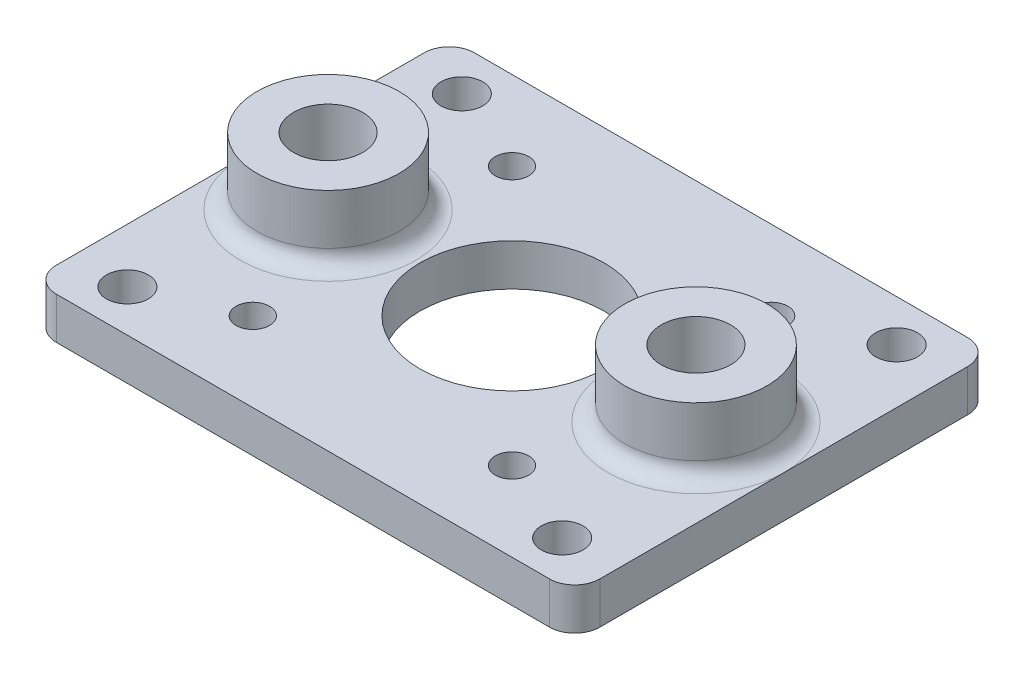
from build123d import *

# Parameters (mm, degrees)
SKETCH1_W           = 65
SKETCH1_H           = 50
SKETCH1_R           = 11
SKETCH1_R_2         = 2
SKETCH1_R_3         = 2.5
BOSS_EXTRUDE1_DEPTH = 5
SKETCH2_R           = 8.5
SKETCH2_R_2         = 4.15
BOSS_EXTRUDE2_DEPTH = 8
FILLET1_R           = 3
CUT_EXTRUDE1_START  = -8
SKETCH3_R           = 4.15
CUT_EXTRUDE1_DEPTH  = 8
FILLET2_R           = 2


with BuildPart() as part:
    # Sketch1 → Boss-Extrude1 (new body)
    with BuildSketch(Plane(origin=(0, 0, 0), x_dir=(1, 0, 0), z_dir=(0, 1, 0))):
        Rectangle(SKETCH1_W, SKETCH1_H)
        with Locations(Location((0, 0, 0), (0, 0, 270))):
            Circle(SKETCH1_R, mode=Mode.SUBTRACT)
        with Locations(Location((15.5, 15.5, 0), (0, 0, 270))):
            Circle(SKETCH1_R_2, mode=Mode.SUBTRACT)
        with Locations(Location((-15.5, 15.5, 0), (0, 0, 270))):
            Circle(SKETCH1_R_2, mode=Mode.SUBTRACT)
        with Locations(Location((15.5, -15.5, 0), (0, 0, 270))):
            Circle(SKETCH1_R_2, mode=Mode.SUBTRACT)
        with Locations(Location((-15.5, -15.5, 0), (0, 0, 270))):
            Circle(SKETCH1_R_2, mode=Mode.SUBTRACT)
        with Locations(Location((26, 20, 0), (0, 0, 270))):
            Circle(SKETCH1_R_3, mode=Mode.SUBTRACT)
        with Locations(Location((-26, 20, 0), (0, 0, 270))):
            Circle(SKETCH1_R_3, mode=Mode.SUBTRACT)
        with Locations(Location((-26, -20, 0), (0, 0, 270))):
            Circle(SKETCH1_R_3, mode=Mode.SUBTRACT)
        with Locations(Location((26, -20, 0), (0, 0, 270))):
            Circle(SKETCH1_R_3, mode=Mode.SUBTRACT)
    extrude(amount=BOSS_EXTRUDE1_DEPTH)

    # Sketch2 → Boss-Extrude2 (add)
    # profile 1 of 2: a face of its own
    with BuildSketch(Plane(origin=(0, 5, 0), x_dir=(1, 0, 0), z_dir=(0, 1, 0))):
        with Locations(Location((22, 0, 0), (0, 0, 270))):
            Circle(SKETCH2_R)
        with Locations(Location((22, 0, 0), (0, 0, 270))):
            Circle(SKETCH2_R_2, mode=Mode.SUBTRACT)
    # profile 2 of 2: a face of its own
    with BuildSketch(Plane(origin=(0, 5, 0), x_dir=(1, 0, 0), z_dir=(0, 1, 0))):
        with Locations(Location((-22, 0, 0), (0, 0, 90))):
            Circle(SKETCH2_R)
        with Locations(Location((-22, 0, 0), (0, 0, 90))):
            Circle(SKETCH2_R_2, mode=Mode.SUBTRACT)
    extrude(amount=BOSS_EXTRUDE2_DEPTH)

    # Fillet1
    fillet1_edges = [part.edges().sort_by_distance(p)[0] for p in [
        (32.5, 2.5, 25),
        (-32.5, 2.5, 25),
        (-32.5, 2.5, -25),
        (32.5, 2.5, -25),
    ]]
    fillet(fillet1_edges, radius=FILLET1_R)

    # Sketch3 → Cut-Extrude1 (cut)
    with BuildSketch(Plane(origin=(0, 5, 0), x_dir=(1, 0, 0), z_dir=(0, 1, 0)).offset(CUT_EXTRUDE1_START)):
        with Locations(Location((-22, 0, 0), (0, 0, 90))):
            Circle(SKETCH3_R)
        with Locations(Location((22, 0, 0), (0, 0, 270))):
            Circle(SKETCH3_R)
    extrude(amount=CUT_EXTRUDE1_DEPTH, mode=Mode.SUBTRACT)

    # Fillet2
    fillet2_edges = [part.edges().sort_by_distance(p)[0] for p in [
        (22, 5, -8.5),
        (-22, 5, 8.5),
    ]]
    fillet(fillet2_edges, radius=FILLET2_R - 0.0001)  # a hair under: the kernel refuses the full size


solid = part.part
